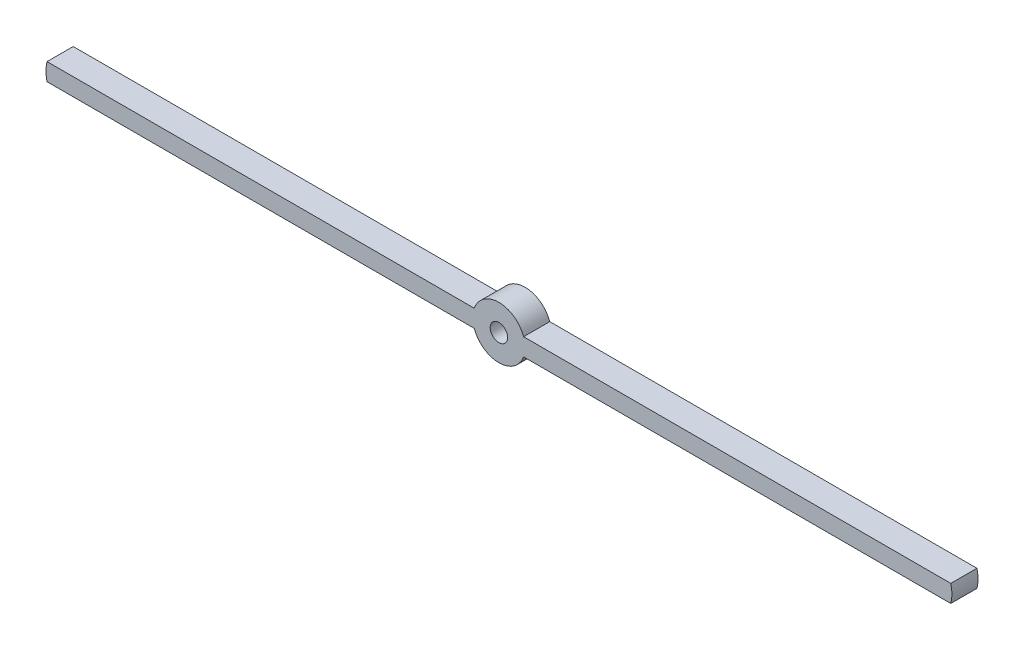
from build123d import *

# Parameters (mm, degrees)
ESQUISSE1_R        = 2
BOSS_EXTRU_1_DEPTH = 6


with BuildPart() as part:
    # Esquisse1 → Boss.-Extru.1 (new body)
    with BuildSketch(Plane.XY):
        with BuildLine():
            ThreePointArc((5.656854249, 2), (0, 6), (-5.656854249, 2))
            Line((-5.656854249, 2), (-103.656854249, 2))
            ThreePointArc((-103.656854249, 2), (-103.910887557, 0), (-103.656854249, -2))
            Line((-103.656854249, -2), (-5.656854249, -2))
            ThreePointArc((-5.656854249, -2), (0, -6), (5.656854249, -2))
            Line((5.656854249, -2), (103.656854249, -2))
            ThreePointArc((103.656854249, -2), (103.910887557, 0), (103.656854249, 2))
            Line((103.656854249, 2), (5.656854249, 2))
        make_face()
        Circle(ESQUISSE1_R, mode=Mode.SUBTRACT)
    extrude(amount=BOSS_EXTRU_1_DEPTH)


solid = part.part
